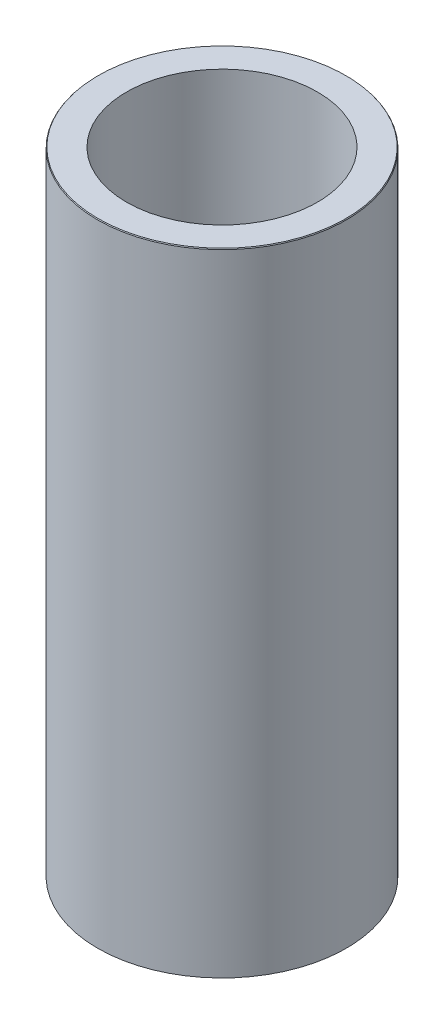
from build123d import *
from OCP.BRepFilletAPI import BRepFilletAPI_MakeChamfer

# Parameters (mm, degrees)
SKETCH1_R           = 52.5
BOSS_EXTRUDE1_DEPTH = 266.758775992
SKETCH2_R           = 40.295553924
CUT_EXTRUDE1_DEPTH  = 277.898437281
CHAMFER1_SIZE       = 0.371226696
CHAMFER1_SIZE2      = 0.228248163


with BuildPart() as part:
    # Sketch1 → Boss-Extrude1 (new body)
    with BuildSketch(Plane(origin=(0, 0, 0), x_dir=(1, 0, 0), z_dir=(0, 1, 0))):
        Circle(SKETCH1_R)
    extrude(amount=BOSS_EXTRUDE1_DEPTH)

    # Sketch2 → Cut-Extrude1 (cut, through all)
    with BuildSketch(Plane(origin=(0, 0, 0), x_dir=(1, 0, 0), z_dir=(0, 1, 0))):
        Circle(SKETCH2_R)
    extrude(amount=CUT_EXTRUDE1_DEPTH, mode=Mode.SUBTRACT)

    # Chamfer1: one chamfer whose edges measure the first distance from different faces: ONE call of the kernel's chamfer builder (chamfer() names one face for all edges)
    chamfer1_edges_1 = [part.edges().sort_by_distance(p)[0] for p in [
        (-52.5, 266.758775992, 0),
    ]]
    chamfer1_side_1 = [part.faces().sort_by_distance(p)[0] for p in [
        (-52.5, 133.379387996, 0),
    ]]
    chamfer1_edges_2 = [part.edges().sort_by_distance(p)[0] for p in [
        (-52.5, 0, 0),
    ]]
    chamfer1_side_2 = [part.faces().sort_by_distance(p)[0] for p in [
        (-51.01507576, 0, 0),
    ]]
    chamfer1 = BRepFilletAPI_MakeChamfer(part.part.solid().wrapped)
    for e in chamfer1_edges_1:
        chamfer1.Add(CHAMFER1_SIZE, CHAMFER1_SIZE2, e.wrapped, chamfer1_side_1[0].wrapped)  # the first distance lies on this face
    for e in chamfer1_edges_2:
        chamfer1.Add(CHAMFER1_SIZE, CHAMFER1_SIZE2, e.wrapped, chamfer1_side_2[0].wrapped)  # the first distance lies on this face
    add(Compound.cast(chamfer1.Shape()), mode=Mode.REPLACE)


solid = part.part
